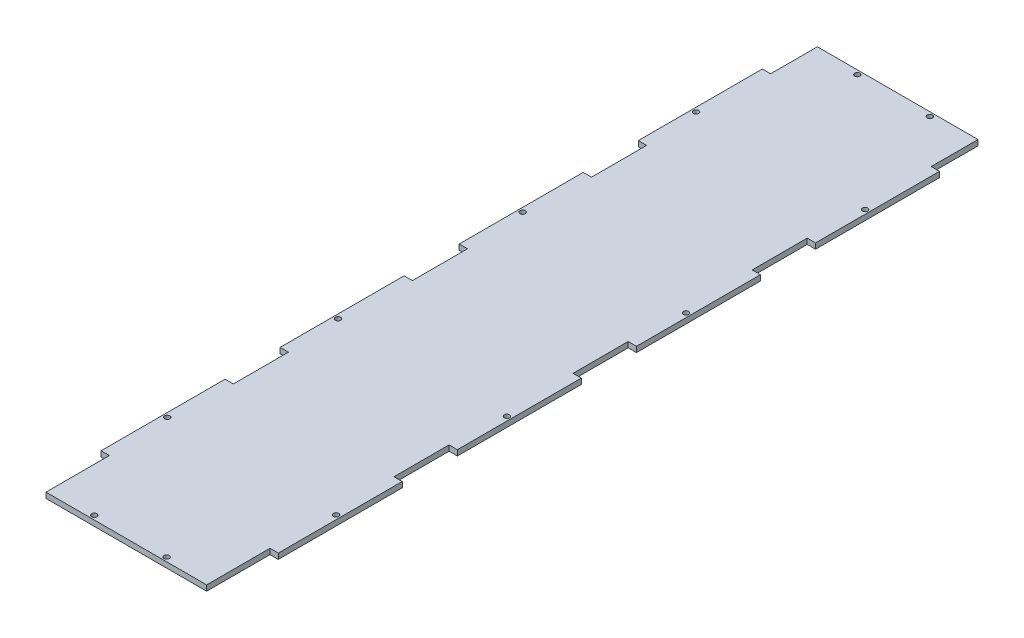
from build123d import *

# Parameters (mm, degrees)
SKETCH1_R           = 1.524
BOSS_EXTRUDE1_DEPTH = 3.175


with BuildPart() as part:
    # Sketch1 → Boss-Extrude1 (new body)
    with BuildSketch(Plane(origin=(0, 0, 0), x_dir=(1, 0, 0), z_dir=(0, 1, 0))):
        Polygon((46.2788, 0), (-46.2788, 0), (-46.2788, 36.5125), (-51.054, 36.5125), (-51.054, 107.95), (-46.2788, 107.95), (-46.2788, 139.7), (-51.054, 139.7), (-51.054, 211.1375), (-46.2788, 211.1375), (-46.2788, 242.8875), (-51.054, 242.8875), (-51.054, 314.325), (-46.2788, 314.325), (-46.2788, 346.075), (-51.054, 346.075), (-51.054, 417.5125), (-46.2788, 417.5125), (-46.2788, 444.4873), (46.2788, 444.4873), (46.2788, 417.5125), (51.054, 417.5125), (51.054, 346.075), (46.2788, 346.075), (46.2788, 314.325), (51.054, 314.325), (51.054, 242.8875), (46.2788, 242.8875), (46.2788, 211.1375), (51.054, 211.1375), (51.054, 139.7), (46.2788, 139.7), (46.2788, 107.95), (51.054, 107.95), (51.054, 36.5125), (46.2788, 36.5125), align=None)
        with Locations((-48.67275, 72.23125)):
            Circle(SKETCH1_R, mode=Mode.SUBTRACT)
        with Locations((48.67275, 377.03125)):
            Circle(SKETCH1_R, mode=Mode.SUBTRACT)
        with Locations((48.67275, 273.84375)):
            Circle(SKETCH1_R, mode=Mode.SUBTRACT)
        with Locations((48.67275, 170.65625)):
            Circle(SKETCH1_R, mode=Mode.SUBTRACT)
        with Locations((-48.67275, 170.65625)):
            Circle(SKETCH1_R, mode=Mode.SUBTRACT)
        with Locations((-48.67275, 277.01875)):
            Circle(SKETCH1_R, mode=Mode.SUBTRACT)
        with Locations((-48.67275, 377.03125)):
            Circle(SKETCH1_R, mode=Mode.SUBTRACT)
        with Locations((48.67275, 72.23125)):
            Circle(SKETCH1_R, mode=Mode.SUBTRACT)
        with Locations((-20.8788, 442.10605)):
            Circle(SKETCH1_R, mode=Mode.SUBTRACT)
        with Locations((20.8788, 442.10605)):
            Circle(SKETCH1_R, mode=Mode.SUBTRACT)
        with Locations((-20.8788, 2.38125)):
            Circle(SKETCH1_R, mode=Mode.SUBTRACT)
        with Locations((20.8788, 2.38125)):
            Circle(SKETCH1_R, mode=Mode.SUBTRACT)
    extrude(amount=BOSS_EXTRUDE1_DEPTH)


solid = part.part
